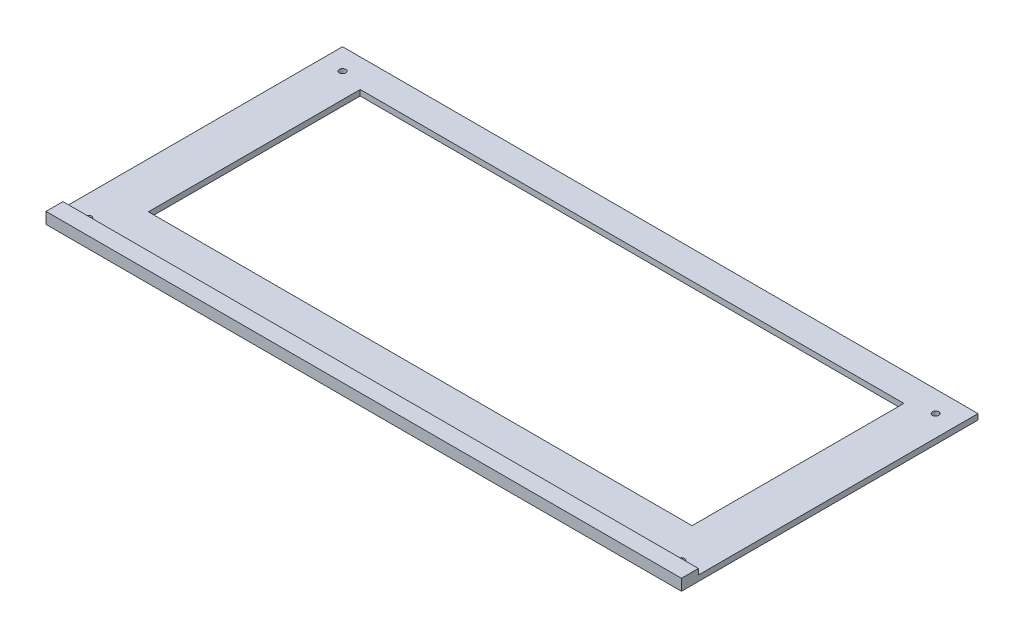
from build123d import *

# Parameters (mm, degrees)
F_01_GUARD_OUTLINE_W      = 900
F_01_GUARD_OUTLINE_H      = 420
F_01_GUARD_OUTLINE_R      = 4.5
F_01_GUARD_OUTLINE_W_2    = 770
F_01_GUARD_OUTLINE_H_2    = 300
F_01_GUARD_PANEL_DEPTH    = 8
F_02_FRAME_RAIL_PROFILE_W = 900
F_02_FRAME_RAIL_PROFILE_H = 24
F_02_FRAME_RAIL_DEPTH     = 16


with BuildPart() as part:
    # 01_Guard_Outline → 01_Guard_Panel (new body)
    with BuildSketch(Plane(origin=(0, 0, 0), x_dir=(1, 0, 0), z_dir=(0, 1, 0))):
        Rectangle(F_01_GUARD_OUTLINE_W, F_01_GUARD_OUTLINE_H)
        with Locations((-420, -180)):
            Circle(F_01_GUARD_OUTLINE_R, mode=Mode.SUBTRACT)
        with Locations((420, -180)):
            Circle(F_01_GUARD_OUTLINE_R, mode=Mode.SUBTRACT)
        with Locations((-420, 180)):
            Circle(F_01_GUARD_OUTLINE_R, mode=Mode.SUBTRACT)
        with Locations((420, 180)):
            Circle(F_01_GUARD_OUTLINE_R, mode=Mode.SUBTRACT)
        with Locations((0, 20)):
            Rectangle(F_01_GUARD_OUTLINE_W_2, F_01_GUARD_OUTLINE_H_2, mode=Mode.SUBTRACT)
    extrude(amount=F_01_GUARD_PANEL_DEPTH)

    # 02_Frame_Rail_Profile → 02_Frame_Rail (add)
    with BuildSketch(Plane(origin=(0, 0, 0), x_dir=(1, 0, 0), z_dir=(0, 1, 0))):
        with Locations((0, -198)):
            Rectangle(F_02_FRAME_RAIL_PROFILE_W, F_02_FRAME_RAIL_PROFILE_H)
    extrude(amount=F_02_FRAME_RAIL_DEPTH)


solid = part.part
